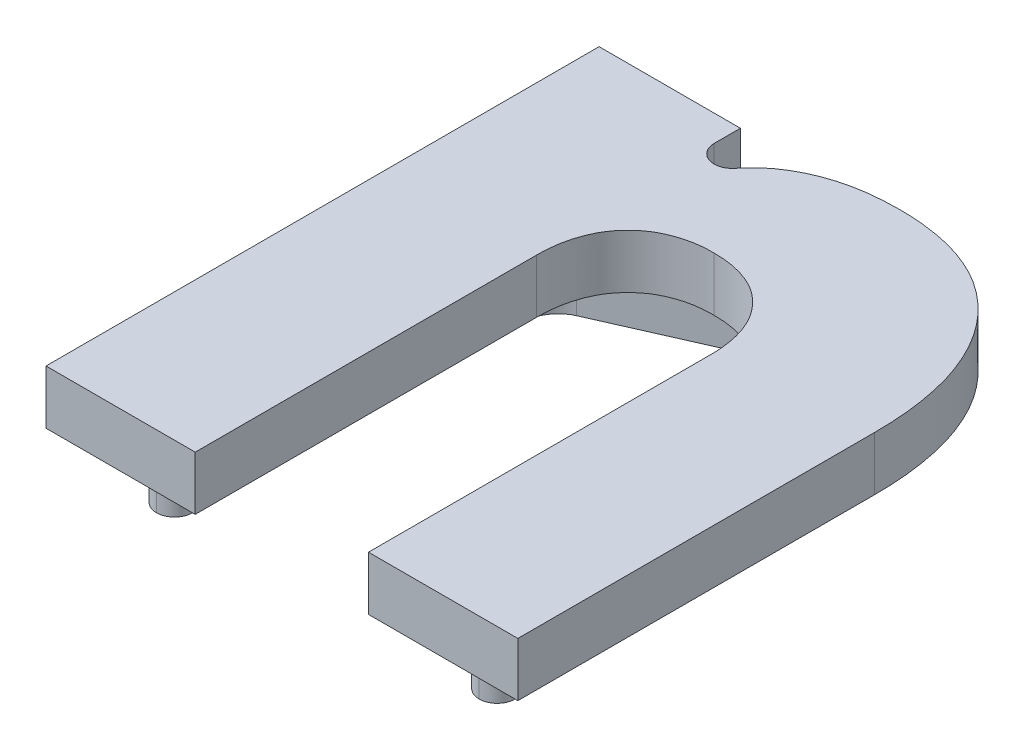
from build123d import *

# Parameters (mm, degrees)
EXTRUDE_N_DEPTH        = 15
EXTRUDE_START          = -15
EXTRUDE_1247_DEPTH     = 15
FILLET_1323_R          = 5
FILLET_1704_R          = 10
SKETCH_1866_R          = 1.5
CUT_EXTRUDE_1874_DEPTH = 205.73302307


# Read off the part's stored shape, not the designer's step: Крепёж подсветки
with BuildPart() as part:
    # Эскиз n → n (new body)
    with BuildSketch(Plane(origin=(0, 0, 0), x_dir=(1, 0, 0), z_dir=(0, 1, 0))):
        with BuildLine():
            Line((0, 153.846153846), (39.299935897, 153.846153846))
            Line((39.299935897, 153.846153846), (39.299935897, 146.547635651))
            ThreePointArc((39.299935897, 146.547635651), (42.668493546, 141.821284431), (48.235294238, 143.463327831))
            add(Edge.make_bspline(
                [(48.235294238, 143.463327831), (48.680235544, 144.031041426), (49.805362072, 145.350365147), (51.780881441, 147.296733708), (54.221156894, 149.205536006), (56.895496579, 150.901537566), (59.76640372, 152.374012934), (62.852222566, 153.625097643), (66.119942525, 154.659854718), (69.589237805, 155.463125454), (74.594167261, 156.227638993), (78.47972692, 156.380969617), (81.126858974, 156.41025641)],
                knots=[0.312672271, 0.312672271, 0.312672271, 0.312672271, 0.353305114, 0.410247876, 0.468663539, 0.527537938, 0.588459477, 0.650230395, 0.714969493, 0.781418224, 0.850708434, 1, 1, 1, 1], degree=3))
            add(Edge.make_bspline(
                [(81.126858974, 156.41025641), (84.859720001, 156.426218167), (90.317082636, 155.957777721), (97.302679405, 154.400552389), (102.070561998, 152.693026297), (106.574200345, 150.583974492), (110.703488298, 147.904651559), (114.548128603, 144.805781264), (118.036996775, 141.222819891), (121.14631588, 137.227946624), (123.864208469, 132.851585446), (126.126383474, 128.112461575), (128.040546504, 123.027665479), (129.455521339, 117.556714971), (130.87166816, 109.597055945), (131.274075332, 103.391251973), (131.247051282, 99.158653846)],
                knots=[0, 0, 0, 0, 0.129841575, 0.189943736, 0.248604894, 0.305783081, 0.362648635, 0.419493286, 0.477347716, 0.536300993, 0.595380588, 0.656296956, 0.718809931, 0.784206619, 0.852684575, 1, 1, 1, 1], degree=3))
            Line((131.247051282, 99.158653846), (131.247051282, 0))
            Line((131.247051282, 0), (89.700576923, 0))
            Line((89.700576923, 0), (89.700576923, 94.991987179))
            add(Edge.make_bspline(
                [(89.700576923, 94.991987179), (89.724152638, 98.525793473), (89.038605734, 103.707632052), (86.189788042, 109.795689468), (83.284125509, 113.481677505), (79.754151619, 116.49899904), (73.94336902, 119.402249568), (68.995321139, 120.166486998), (65.622051282, 120.112179487)],
                knots=[0, 0, 0, 0, 0.270259745, 0.391050185, 0.508669627, 0.625837927, 0.742508846, 1, 1, 1, 1], degree=3))
            add(Edge.make_bspline(
                [(65.622051282, 120.112179487), (62.246048707, 120.173531263), (57.293638347, 119.387703313), (51.452904124, 116.499817419), (47.884444323, 113.49367552), (44.967404733, 109.804274849), (42.196227012, 103.687541079), (41.462060906, 98.533886415), (41.503461538, 94.991987179)],
                knots=[0, 0, 0, 0, 0.257168251, 0.374600508, 0.492402658, 0.609874601, 0.73007917, 1, 1, 1, 1], degree=3))
            Line((41.503461538, 94.991987179), (41.503461538, 0))
            Line((41.503461538, 0), (0, 0))
            Line((0, 0), (0, 153.846153846))
        make_face()
    extrude(amount=EXTRUDE_N_DEPTH)

    # Extrude 1247 outline → Extrude 1247 (add)
    with BuildSketch(Plane(origin=(0, 0, 0), x_dir=(1, 0, 0), z_dir=(0, 1, 0)).offset(EXTRUDE_START)):
        with BuildLine():
            Line((15.751731, 10), (25.751731, 10))
            Line((25.751731, 10), (25.751731, 113.28080684))
            Line((25.751731, 113.28080684), (65.409736151, 130.790882853))
            ThreePointArc((65.409736151, 130.790882853), (92.515549907, 128.594316344), (105.473237, 104.685146786))
            Line((105.473237, 104.685146786), (105.473237, 10))
            Line((105.473237, 10), (115.473237, 10))
            Line((115.473237, 10), (115.473237, 104.685146786))
            ThreePointArc((115.473237, 104.685146786), (97.974906411, 136.97258744), (61.370650839, 139.938876614))
            Line((61.370650839, 139.938876614), (25.751731, 124.212165411))
            Line((25.751731, 124.212165411), (25.751731, 143.85))
            Line((25.751731, 143.85), (15.751731, 143.85))
            Line((15.751731, 143.85), (15.751731, 10))
        make_face()
    extrude(amount=EXTRUDE_1247_DEPTH)

    # Fillet 1323
    fillet_1323_edges = [part.edges().sort_by_distance(p)[0] for p in [
        (25.751731, -7.5, -143.85),
        (15.751731, -7.5, -143.85),
        (15.751731, -7.5, -10),
        (25.751731, -7.5, -10),
        (105.473237, -7.5, -10),
        (115.473237, -7.5, -10),
    ]]
    fillet(fillet_1323_edges, radius=FILLET_1323_R - 0.0001)  # a hair under: the kernel refuses the full size

    # Fillet 1704
    fillet_1704_edges = [part.edges().sort_by_distance(p)[0] for p in [
        (25.751731, -7.5, -124.212165411),
        (25.751731, -7.5, -113.28080684),
    ]]
    fillet(fillet_1704_edges, radius=FILLET_1704_R)

    # Sketch 1866 → Cut-Extrude 1874 (cut, through all)
    with BuildSketch(Plane(origin=(0, 0, 0), x_dir=(1, 0, 0), z_dir=(0, 1, 0))):
        with Locations(Location((98.28, 130.55, 0), (0, 0, 270))):
            Circle(SKETCH_1866_R)
        with Locations(Location((20.751731, 15, 0), (0, 0, 270))):
            Circle(SKETCH_1866_R)
        with Locations(Location((110.473237, 15, 0), (0, 0, 270))):
            Circle(SKETCH_1866_R)
    extrude(amount=-CUT_EXTRUDE_1874_DEPTH, mode=Mode.SUBTRACT)


solid = part.part
